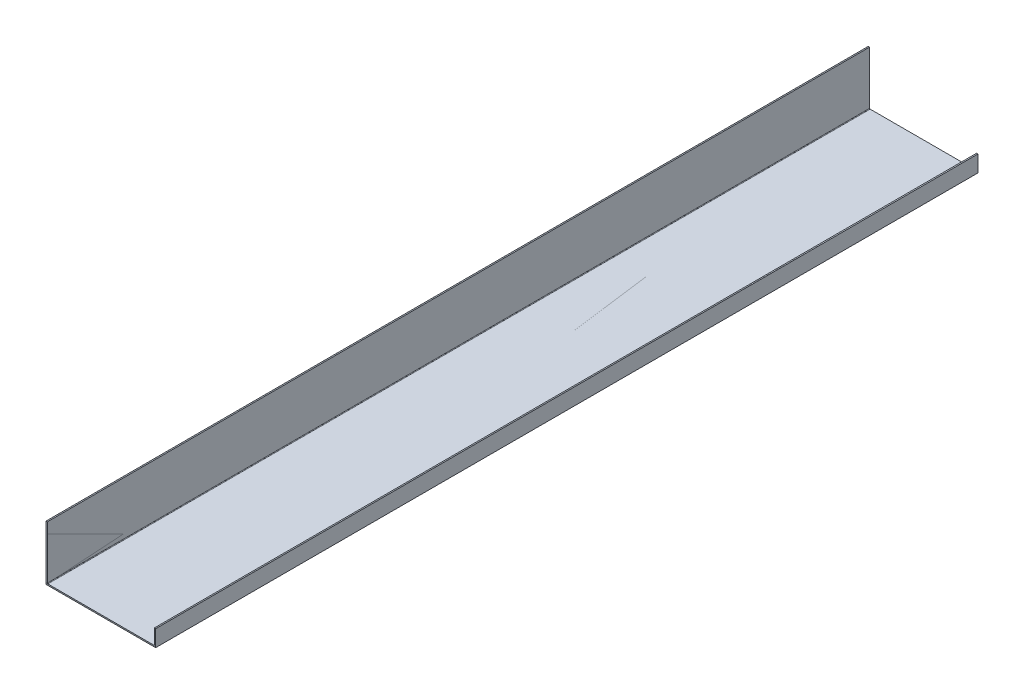
from build123d import *

# Parameters (mm, degrees)
EXTRUDE_2_DEPTH     = 750
SHEET_METAL_3_DEPTH = 750


# Read off the part's stored shape, not the designer's step: Преобразовать-Твердое тело3
with BuildPart() as part:
    # Эскиз3 → Бобышка-Вытянуть2 (new body)
    with BuildSketch(Plane.XY):
        Polygon((0, 0), (0, 50), (1.2, 50), (1.2, 1.2), (98.8, 1.2), (98.8, 15), (100, 15), (100, 0), align=None)
    extrude(amount=EXTRUDE_2_DEPTH)


with BuildPart() as body_2:
    # Sheet Metal 3 outline → Sheet Metal 3 (new body)
    with BuildSketch(Plane.XY):
        with BuildLine():
            Line((1.2, 1.7), (1.2, 50))
            Line((1.2, 50), (0.2, 50))
            Line((0.2, 50), (0.2, 1.7))
            ThreePointArc((0.2, 1.7), (0.639339828, 0.639339828), (1.7, 0.2))
            Line((1.7, 0.2), (98.3, 0.2))
            ThreePointArc((98.3, 0.2), (99.360660172, 0.639339828), (99.8, 1.7))
            Line((99.8, 1.7), (99.8, 15))
            Line((99.8, 15), (98.8, 15))
            Line((98.8, 15), (98.8, 1.7))
            ThreePointArc((98.8, 1.7), (98.653553391, 1.346446609), (98.3, 1.2))
            Line((98.3, 1.2), (1.7, 1.2))
            ThreePointArc((1.7, 1.2), (1.346446609, 1.346446609), (1.2, 1.7))
        make_face()
    extrude(amount=SHEET_METAL_3_DEPTH)


solid = Compound([part.part, body_2.part])
